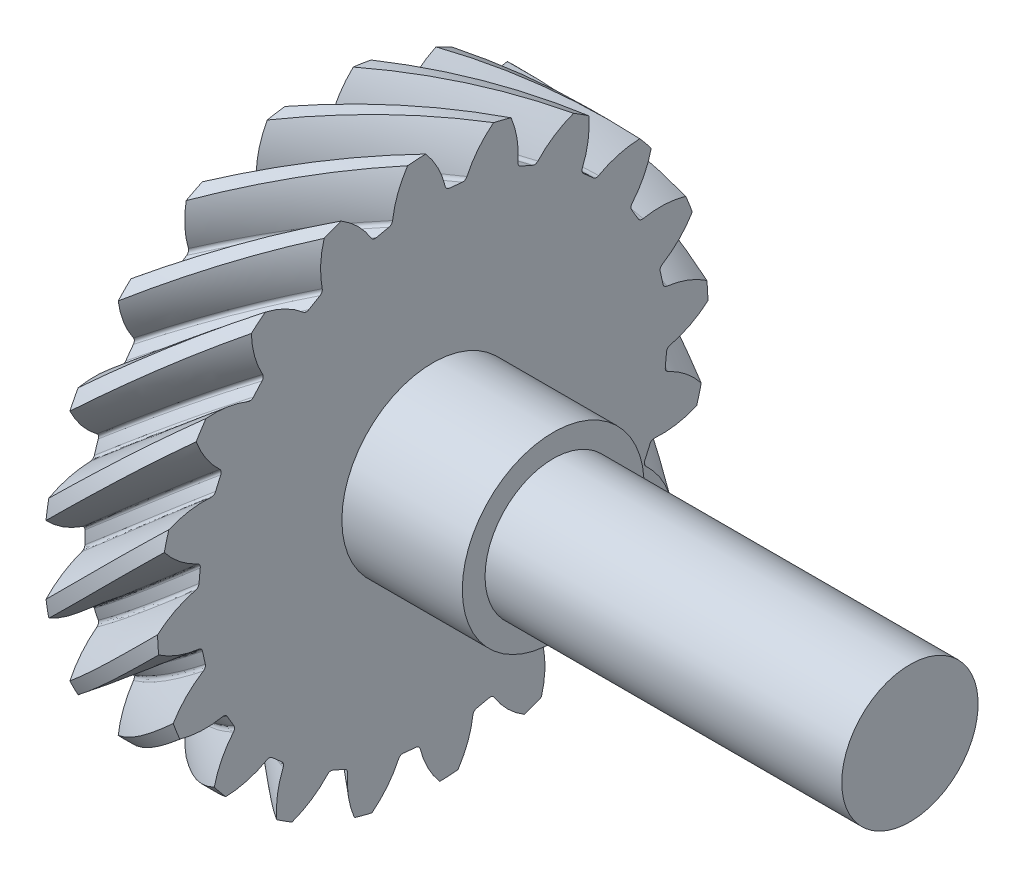
from build123d import *

# Parameters (mm, degrees)
BASPROSKE_W             = 5
BASPROSKE_H             = 12.113708499
TOOTHCUTLH_PITCH        = 76.112675256
TOOTHCUTLH_HEIGHT       = 5
TOOTHCUTLH_RADIUS       = 12.113708499
TOOTHCUTLH_START_ANGLE  = -90
TEETHCUTSLH_COUNT       = 20
TEETHCUTSLH_ANGLE       = 342
BORSKE_R                = 0.5
BORE_DEPTH              = 62.5000025
SKETCH4_R               = 3
BOSS_EXTRUDE1_DEPTH     = 26
SKETCH5_R               = 4
BOSS_EXTRUDE2_DEPTH     = 10.3
CUT_EXTRUDE1_DEPTH      = 8
CUT_EXTRUDE1_DEPTH_BACK = 12
SKETCH6_R               = 1.55


with BuildPart() as part:
    # BasProSke → Base-Revolve (revolve)
    with BuildSketch(Plane(origin=(0, 0, 0), x_dir=(1, 0, 0), z_dir=(0, 1, 0)), mode=Mode.PRIVATE) as base_revolve_sk:
        with Locations((2.5, 6.05685425)):
            Rectangle(BASPROSKE_W, BASPROSKE_H)
    revolve(base_revolve_sk.sketch.rotate(Axis((-10, 0, 0), (1, 0, 0)), 180), axis=Axis((-10, 0, 0), (1, 0, 0)))

    # ToothCutLH: sweep along a helix
    with BuildLine() as toothcutlh_path:
        add(Helix(TOOTHCUTLH_PITCH, TOOTHCUTLH_HEIGHT, TOOTHCUTLH_RADIUS, center=(0, 0, 0), direction=(1, 0, 0), lefthand=True, mode=Mode.PRIVATE).rotate(Axis((0, 0, 0), (1, 0, 0)), TOOTHCUTLH_START_ANGLE))
    # TooCutSkeRH<3> → ToothCutLH (sweep, cut)
    with BuildSketch(Plane(origin=(0, 0, 0), x_dir=(0, 0, -1), z_dir=(1, 0, 0))):
        with BuildLine():
            ThreePointArc((0.283462707, 10.309812408), (0, 10.313708499), (-0.283462707, 10.309812408))
            ThreePointArc((-0.283462707, 10.309812408), (-0.402896237, 10.345129453), (-0.47859517, 10.444030076))
            ThreePointArc((-0.47859517, 10.444030076), (-1.035614295, 11.494681177), (-1.876899707, 12.335143487))
            ThreePointArc((-1.876899707, 12.335143487), (0, 12.477119754), (1.876899707, 12.335143487))
            ThreePointArc((1.876899707, 12.335143487), (1.035614295, 11.494681177), (0.47859517, 10.444030076))
            ThreePointArc((0.47859517, 10.444030076), (0.402896237, 10.345129453), (0.283462707, 10.309812408))
        make_face()
    toothcutlh = sweep(path=toothcutlh_path.line, is_frenet=True, mode=Mode.SUBTRACT)

    # TeethCutsLH: ToothCutLH ×20 about axis
    teethcutslh_axis = Axis((-10, 0, 0), (1, 0, 0))
    for i in range(1, TEETHCUTSLH_COUNT):
        add(toothcutlh.rotate(teethcutslh_axis, i * TEETHCUTSLH_ANGLE / (TEETHCUTSLH_COUNT - 1)), mode=Mode.SUBTRACT)

    # BorSke → Bore (cut, symmetric)
    with BuildSketch(Plane(origin=(0, 0, 0), x_dir=(0, 0, -1), z_dir=(1, 0, 0))):
        with Locations(Location((0, 0, 0), (0, 0, 180))):
            Circle(BORSKE_R)
    extrude(amount=BORE_DEPTH, both=True, mode=Mode.SUBTRACT)

    # Sketch4 → Boss-Extrude1 (add)
    with BuildSketch(Plane(origin=(0, 0, 0), x_dir=(0, 0, -1), z_dir=(1, 0, 0))):
        with Locations(Location((0, 0, 0), (0, 0, 180))):
            Circle(SKETCH4_R)
    extrude(amount=BOSS_EXTRUDE1_DEPTH)

    # Sketch5 → Boss-Extrude2 (add)
    with BuildSketch(Plane(origin=(0, 0, 0), x_dir=(0, 0, -1), z_dir=(1, 0, 0))):
        with Locations(Location((0, 0, 0), (0, 0, 180))):
            Circle(SKETCH5_R)
    extrude(amount=BOSS_EXTRUDE2_DEPTH)

    # Sketch6 → Cut-Extrude1 (cut, two sides: drawn at the far end of the back side and taken through both)
    with BuildSketch(Plane(origin=(0, 0, 0), x_dir=(0, 0, -1), z_dir=(1, 0, 0)).offset(-CUT_EXTRUDE1_DEPTH_BACK)):
        Circle(SKETCH6_R)
    extrude(amount=CUT_EXTRUDE1_DEPTH + CUT_EXTRUDE1_DEPTH_BACK, mode=Mode.SUBTRACT)


solid = part.part
